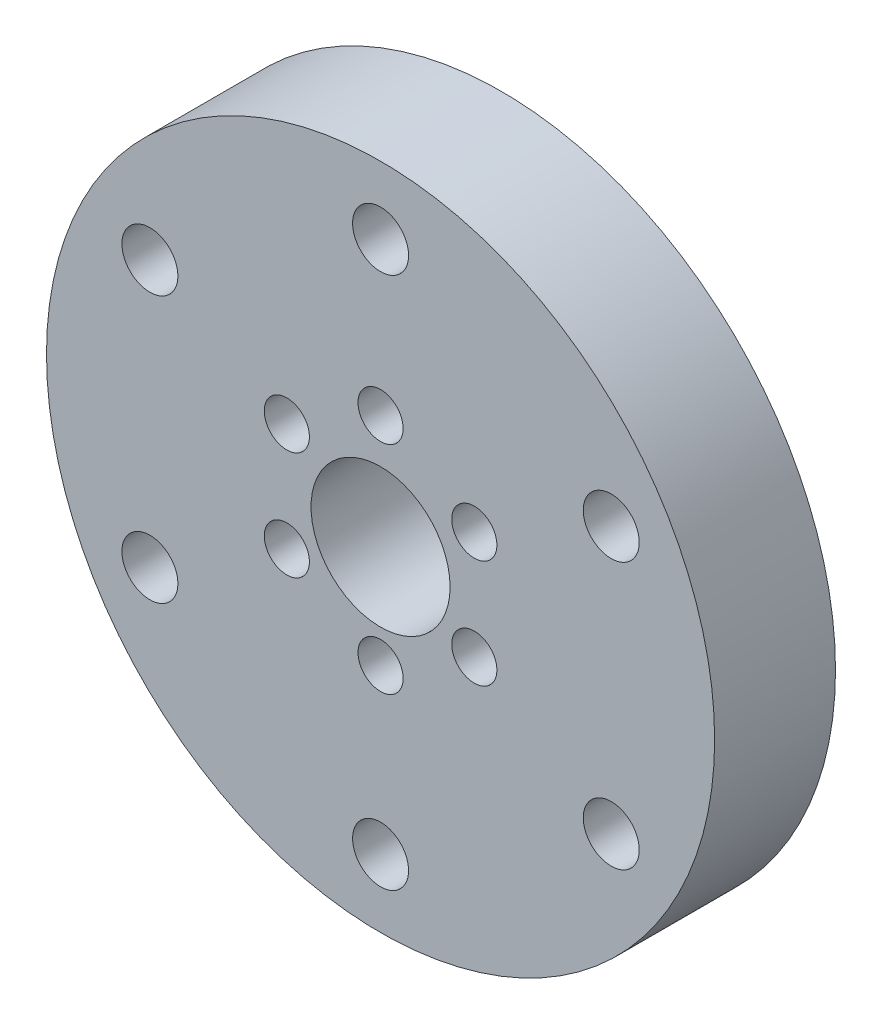
from build123d import *

# Parameters (mm, degrees)
SKETCH1_R           = 46.99
SKETCH1_R_2         = 9.779
SKETCH1_R_3         = 3.175
SKETCH1_R_4         = 3.937
BOSS_EXTRUDE3_DEPTH = 17.000000036


with BuildPart() as part:
    # Sketch1 → Boss-Extrude3 (new body)
    with BuildSketch(Plane.XY):
        Circle(SKETCH1_R)
        Circle(SKETCH1_R_2, mode=Mode.SUBTRACT)
        with Locations((0, 16.002)):
            Circle(SKETCH1_R_3, mode=Mode.SUBTRACT)
        with Locations((13.184862266, 8.389716222)):
            Circle(SKETCH1_R_3, mode=Mode.SUBTRACT)
        with Locations((13.184862266, -6.834851335)):
            Circle(SKETCH1_R_3, mode=Mode.SUBTRACT)
        with Locations((0, -14.447135113)):
            Circle(SKETCH1_R_3, mode=Mode.SUBTRACT)
        with Locations((-13.184862266, -6.834851335)):
            Circle(SKETCH1_R_3, mode=Mode.SUBTRACT)
        with Locations((-13.184862266, 8.389716222)):
            Circle(SKETCH1_R_3, mode=Mode.SUBTRACT)
        with Locations((0, 37.465)):
            Circle(SKETCH1_R_4, mode=Mode.SUBTRACT)
        with Locations((32.445641753, 18.7325)):
            Circle(SKETCH1_R_4, mode=Mode.SUBTRACT)
        with Locations((32.445641753, -18.7325)):
            Circle(SKETCH1_R_4, mode=Mode.SUBTRACT)
        with Locations((0, -37.465)):
            Circle(SKETCH1_R_4, mode=Mode.SUBTRACT)
        with Locations((-32.445641753, -18.7325)):
            Circle(SKETCH1_R_4, mode=Mode.SUBTRACT)
        with Locations((-32.445641753, 18.7325)):
            Circle(SKETCH1_R_4, mode=Mode.SUBTRACT)
    extrude(amount=BOSS_EXTRUDE3_DEPTH)


solid = part.part
